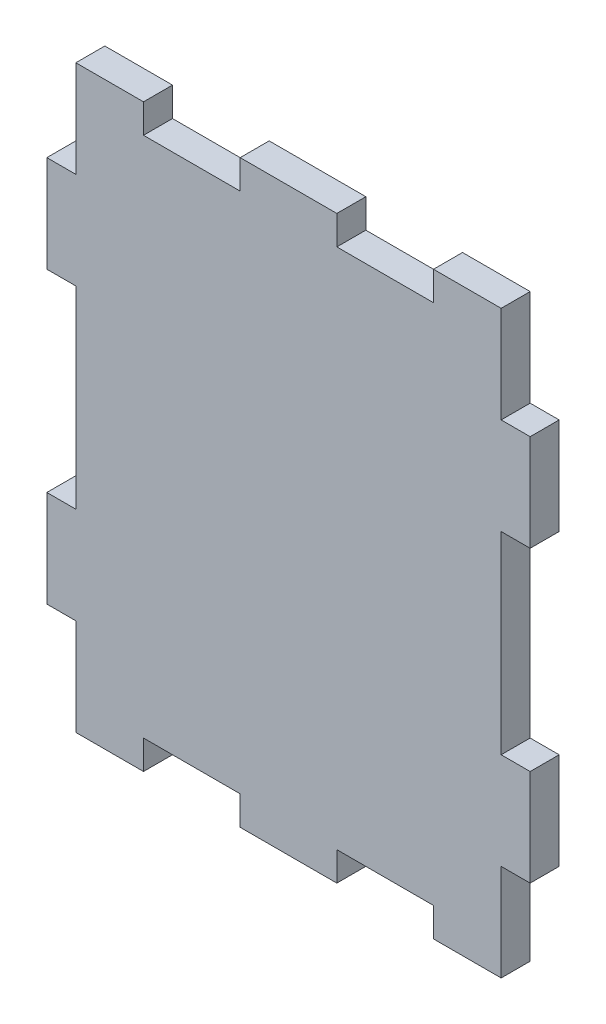
from build123d import *

# Parameters (mm, degrees)
SKETCH1_W             = 50
SKETCH1_H             = 60
BOSS_EXTRUDE1_DEPTH   = 3
CAVITY8_START         = -10
CAVITY8_OUTLINE_W     = 3
CAVITY8_OUTLINE_H     = 3
CAVITY8_DEPTH         = 20
CAVITY8_START_2       = -30
CAVITY8_2_OUTLINE_W   = 10
CAVITY8_2_OUTLINE_H   = 3
CAVITY8_2_OUTLINE_W_2 = 3
CAVITY8_2_DEPTH       = 3
CAVITY8_START_3       = 27
CAVITY8_3_OUTLINE_W   = 10
CAVITY8_3_OUTLINE_H   = 3
CAVITY8_3_OUTLINE_W_2 = 3
CAVITY8_3_DEPTH       = 3
CAVITY8_START_4       = -27
CAVITY8_4_OUTLINE_W   = 3
CAVITY8_4_OUTLINE_H   = 3
CAVITY8_4_DEPTH       = 7
CAVITY8_START_5       = 20
CAVITY8_5_OUTLINE_W   = 3
CAVITY8_5_OUTLINE_H   = 3
CAVITY8_5_DEPTH       = 7


# Read off the part's stored shape, not the designer's step: Cavity8
with BuildPart() as part:
    # Sketch1 → Boss-Extrude1 (new body)
    with BuildSketch(Plane.XY):
        Rectangle(SKETCH1_W, SKETCH1_H)
    extrude(amount=BOSS_EXTRUDE1_DEPTH)

    # Cavity8 outline → Cavity8 (cut)
    with BuildSketch(Plane(origin=(0, 0, 0), x_dir=(1, 0, 0), z_dir=(0, 1, 0)).offset(CAVITY8_START)):
        with Locations((23.5, -1.5)):
            Rectangle(CAVITY8_OUTLINE_W, CAVITY8_OUTLINE_H)
        with Locations((-23.5, -1.5)):
            Rectangle(CAVITY8_OUTLINE_W, CAVITY8_OUTLINE_H)
    extrude(amount=CAVITY8_DEPTH, mode=Mode.SUBTRACT)

    # Cavity8 2 outline → Cavity8 2 (cut)
    with BuildSketch(Plane(origin=(0, 0, 0), x_dir=(1, 0, 0), z_dir=(0, 1, 0)).offset(CAVITY8_START_2)):
        with Locations((10, -1.5)):
            Rectangle(CAVITY8_2_OUTLINE_W, CAVITY8_2_OUTLINE_H)
        with Locations((-10, -1.5)):
            Rectangle(CAVITY8_2_OUTLINE_W, CAVITY8_2_OUTLINE_H)
        with Locations((23.5, -1.5)):
            Rectangle(CAVITY8_2_OUTLINE_W_2, CAVITY8_2_OUTLINE_H)
        with Locations((-23.5, -1.5)):
            Rectangle(CAVITY8_2_OUTLINE_W_2, CAVITY8_2_OUTLINE_H)
    extrude(amount=CAVITY8_2_DEPTH, mode=Mode.SUBTRACT)

    # Cavity8 3 outline → Cavity8 3 (cut)
    with BuildSketch(Plane(origin=(0, 0, 0), x_dir=(1, 0, 0), z_dir=(0, 1, 0)).offset(CAVITY8_START_3)):
        with Locations((10, -1.5)):
            Rectangle(CAVITY8_3_OUTLINE_W, CAVITY8_3_OUTLINE_H)
        with Locations((-10, -1.5)):
            Rectangle(CAVITY8_3_OUTLINE_W, CAVITY8_3_OUTLINE_H)
        with Locations((23.5, -1.5)):
            Rectangle(CAVITY8_3_OUTLINE_W_2, CAVITY8_3_OUTLINE_H)
        with Locations((-23.5, -1.5)):
            Rectangle(CAVITY8_3_OUTLINE_W_2, CAVITY8_3_OUTLINE_H)
    extrude(amount=CAVITY8_3_DEPTH, mode=Mode.SUBTRACT)

    # Cavity8 4 outline → Cavity8 4 (cut)
    with BuildSketch(Plane(origin=(0, 0, 0), x_dir=(1, 0, 0), z_dir=(0, 1, 0)).offset(CAVITY8_START_4)):
        with Locations((23.5, -1.5)):
            Rectangle(CAVITY8_4_OUTLINE_W, CAVITY8_4_OUTLINE_H)
        with Locations((-23.5, -1.5)):
            Rectangle(CAVITY8_4_OUTLINE_W, CAVITY8_4_OUTLINE_H)
    extrude(amount=CAVITY8_4_DEPTH, mode=Mode.SUBTRACT)

    # Cavity8 5 outline → Cavity8 5 (cut)
    with BuildSketch(Plane(origin=(0, 0, 0), x_dir=(1, 0, 0), z_dir=(0, 1, 0)).offset(CAVITY8_START_5)):
        with Locations((23.5, -1.5)):
            Rectangle(CAVITY8_5_OUTLINE_W, CAVITY8_5_OUTLINE_H)
        with Locations((-23.5, -1.5)):
            Rectangle(CAVITY8_5_OUTLINE_W, CAVITY8_5_OUTLINE_H)
    extrude(amount=CAVITY8_5_DEPTH, mode=Mode.SUBTRACT)


solid = part.part
